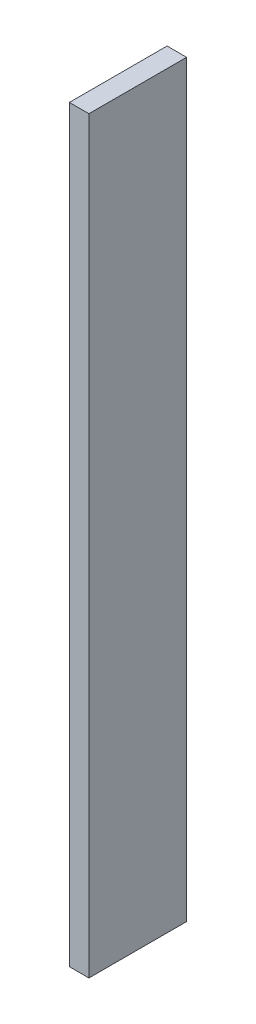
from build123d import *

# Parameters (mm, degrees)
ESQUISSE1_W        = 50
ESQUISSE1_H        = 383
BOSS_EXTRU_1_DEPTH = 10


with BuildPart() as part:
    # Esquisse1 → Boss.-Extru.1 (new body)
    with BuildSketch(Plane(origin=(0, 0, 0), x_dir=(0, 0, -1), z_dir=(1, 0, 0))):
        Rectangle(ESQUISSE1_W, ESQUISSE1_H)
    extrude(amount=BOSS_EXTRU_1_DEPTH)


solid = part.part
